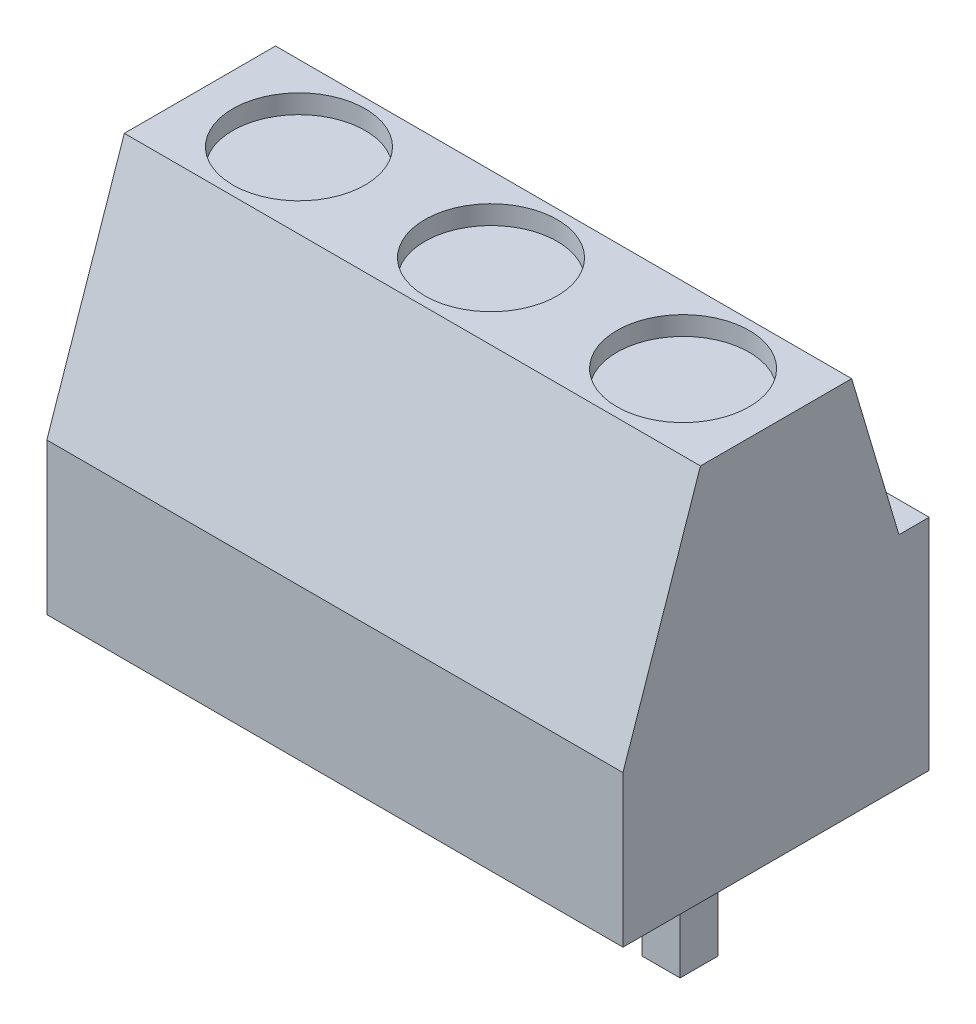
from build123d import *

# Parameters (mm, degrees)
SKETCH3_W             = 15.24
SKETCH3_H             = 8.1
BOSS_EXTRUDE3_DEPTH   = 10
CUT_EXTRUDE1_DEPTH    = 19.672442261
SKETCH5_R             = 1.75
CUT_EXTRUDE2_DEPTH    = 0.5
SKETCH6_W             = 3
SKETCH6_H             = 2
CUT_EXTRUDE4_DEPTH    = 0.5
SKETCH7_W             = 1
SKETCH7_H             = 1
BOSS_EXTRUDE4_DEPTH   = 3.5
LPATTERN2_START       = 4.58
LPATTERN2_OUTLINE_W   = 3.5
LPATTERN2_OUTLINE_H   = 1
LPATTERN2_DEPTH       = 1
LPATTERN2_START_2     = -0.5
LPATTERN2_2_OUTLINE_W = 3.5
LPATTERN2_2_OUTLINE_H = 1
LPATTERN2_2_DEPTH     = 1
LPATTERN2_START_3     = 9.5
LPATTERN2_3_OUTLINE_R = 1.75
LPATTERN2_3_DEPTH     = 0.5
LPATTERN2_START_4     = 1.4
LPATTERN2_4_OUTLINE_W = 3
LPATTERN2_4_OUTLINE_H = 0.5
LPATTERN2_4_DEPTH     = 2


# Read off the part's stored shape, not the designer's step: LPattern2
with BuildPart() as part:
    # Sketch3 → Boss-Extrude3 (new body)
    with BuildSketch(Plane(origin=(0, 0, 0), x_dir=(1, 0, 0), z_dir=(0, 1, 0))):
        Rectangle(SKETCH3_W, SKETCH3_H)
    extrude(amount=BOSS_EXTRUDE3_DEPTH)

    # Sketch4 → Cut-Extrude1 (cut, through all)
    with BuildSketch(Plane.ZY.offset(7.62)):
        Polygon((-3.25, 5.8), (-2, 10), (-3.25, 10), (-4.05, 10), (-4.05, 5.8), align=None)
        Polygon((4.05, 10), (2, 10), (4.05, 4), align=None)
    extrude(amount=-CUT_EXTRUDE1_DEPTH, mode=Mode.SUBTRACT)

    # Sketch5 → Cut-Extrude2 (cut)
    with BuildSketch(Plane(origin=(0, 10, 0), x_dir=(1, 0, 0), z_dir=(0, 1, 0))):
        with Locations(Location((-5, 0, 0), (0, 0, 270))):
            Circle(SKETCH5_R)
    extrude(amount=-CUT_EXTRUDE2_DEPTH, mode=Mode.SUBTRACT)

    # Sketch6 → Cut-Extrude4 (cut)
    with BuildSketch(Plane(origin=(0, 0, -4.05), x_dir=(-1, 0, 0), z_dir=(0, 0, -1))):
        with Locations((5.08, 2.4)):
            Rectangle(SKETCH6_W, SKETCH6_H)
    extrude(amount=-CUT_EXTRUDE4_DEPTH, mode=Mode.SUBTRACT)

    # LPattern2 3 outline → LPattern2 3 (cut)
    with BuildSketch(Plane(origin=(0, 0, 0), x_dir=(1, 0, 0), z_dir=(0, 1, 0)).offset(LPATTERN2_START_3)):
        with Locations((5.16, 0)):
            Circle(LPATTERN2_3_OUTLINE_R)
        with Locations((0.08, 0)):
            Circle(LPATTERN2_3_OUTLINE_R)
    extrude(amount=LPATTERN2_3_DEPTH, mode=Mode.SUBTRACT)

    # LPattern2 4 outline → LPattern2 4 (cut)
    with BuildSketch(Plane(origin=(0, 0, 0), x_dir=(1, 0, 0), z_dir=(0, 1, 0)).offset(LPATTERN2_START_4)):
        with Locations((0, 3.8)):
            Rectangle(LPATTERN2_4_OUTLINE_W, LPATTERN2_4_OUTLINE_H)
        with Locations((5.08, 3.8)):
            Rectangle(LPATTERN2_4_OUTLINE_W, LPATTERN2_4_OUTLINE_H)
    extrude(amount=LPATTERN2_4_DEPTH, mode=Mode.SUBTRACT)


with BuildPart() as body_2:
    # Sketch7 → Boss-Extrude4 (new body)
    with BuildSketch(Plane.XZ):
        with Locations((-5.08, 0)):
            Rectangle(SKETCH7_W, SKETCH7_H)
    extrude(amount=BOSS_EXTRUDE4_DEPTH)


with BuildPart() as body_3:
    # LPattern2 outline → LPattern2 (new body)
    with BuildSketch(Plane.YZ.offset(LPATTERN2_START)):
        with Locations((-1.75, 0)):
            Rectangle(LPATTERN2_OUTLINE_W, LPATTERN2_OUTLINE_H)
    extrude(amount=LPATTERN2_DEPTH)


with BuildPart() as body_4:
    # LPattern2 2 outline → LPattern2 2 (new body)
    with BuildSketch(Plane.YZ.offset(LPATTERN2_START_2)):
        with Locations((-1.75, 0)):
            Rectangle(LPATTERN2_2_OUTLINE_W, LPATTERN2_2_OUTLINE_H)
    extrude(amount=LPATTERN2_2_DEPTH)


solid = Compound([part.part, body_2.part, body_3.part, body_4.part])
